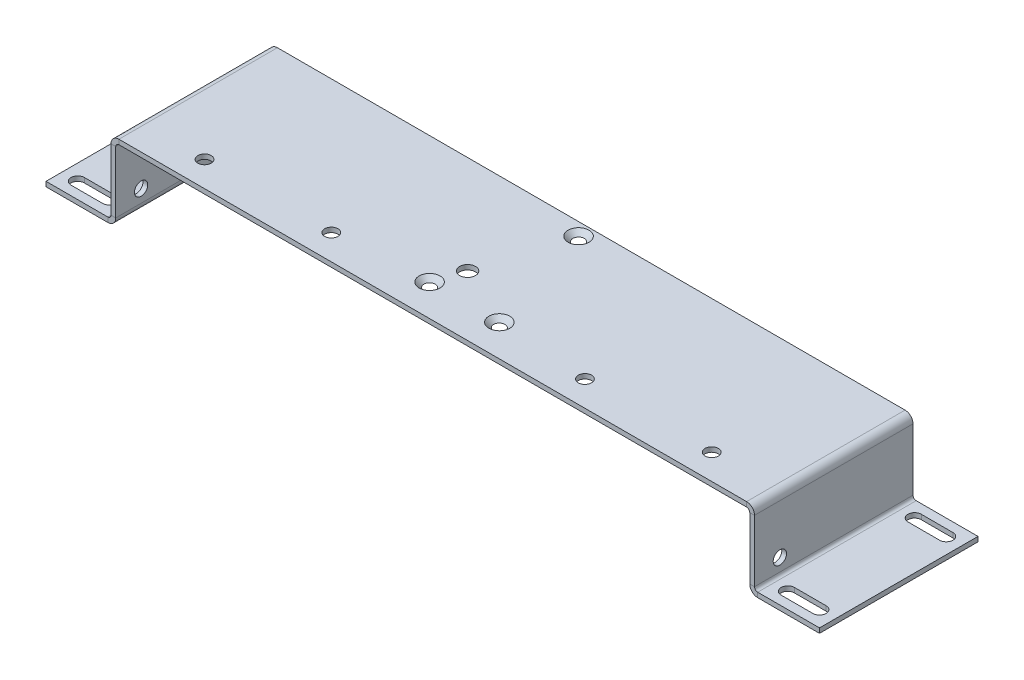
from build123d import *

# Parameters (mm, degrees)
SM_BASE_FLANGE_1_DEPTH       = 50
HOLE_WIZARD_1_AT_2_COUNT     = 2
HOLE_WIZARD_1_AT_2_PITCH     = 37.643060449
HOLE_WIZARD_1_AT_3_COUNT     = 2
HOLE_WIZARD_1_AT_3_PITCH     = 37.643060449
HOLE_WIZARD_4_2_4_2_1_D      = 4.2
HOLE_WIZARD_4_2_4_2_2_REACH  = 232.331
HOLE_WIZARD_4_2_4_2_2_BORE_R = 2.1
CUT_EXTRUDE_1_DEPTH          = 134.839456066
HOLE_WIZARD_5_0_5_1_D        = 5


# Read off the part's stored shape, not the designer's step: 基体-法兰1
with BuildPart() as part:
    # 基体-法兰1 outline → 基体-法兰1 (new body)
    with BuildSketch(Plane.XY):
        with BuildLine():
            Line((102.5, 0), (122, 0))
            Line((122, 0), (122, 1.5))
            Line((122, 1.5), (102.5, 1.5))
            ThreePointArc((102.5, 1.5), (101.792893219, 1.792893219), (101.5, 2.5))
            Line((101.5, 2.5), (101.5, 22))
            ThreePointArc((101.5, 22), (100.767766953, 23.767766953), (99, 24.5))
            Line((99, 24.5), (-99, 24.5))
            ThreePointArc((-99, 24.5), (-100.767766953, 23.767766953), (-101.5, 22))
            Line((-101.5, 22), (-101.5, 2.5))
            ThreePointArc((-101.5, 2.5), (-101.792893219, 1.792893219), (-102.5, 1.5))
            Line((-102.5, 1.5), (-122, 1.5))
            Line((-122, 1.5), (-122, 0))
            Line((-122, 0), (-102.5, 0))
            ThreePointArc((-102.5, 0), (-100.732233047, 0.732233047), (-100, 2.5))
            Line((-100, 2.5), (-100, 22))
            ThreePointArc((-100, 22), (-99.707106781, 22.707106781), (-99, 23))
            Line((-99, 23), (99, 23))
            ThreePointArc((99, 23), (99.707106781, 22.707106781), (100, 22))
            Line((100, 22), (100, 2.5))
            ThreePointArc((100, 2.5), (100.732233047, 0.732233047), (102.5, 0))
        make_face()
    extrude(amount=SM_BASE_FLANGE_1_DEPTH)

    # 草图9 → 打孔尺寸(%根据)开槽沉头木螺钉的类型1 (revolve, cut)
    with BuildSketch(Plane(origin=(0, 24.5, 4), x_dir=(0, 0, 1), z_dir=(1, 0, 0))):
        Polygon((0, 0), (0, 1.5), (1.7, 1.5), (1.7, 1.6), (3.3, 0), align=None)
    hole_wizard_1 = revolve(axis=Axis((0, 30.85, 4), (0, -1, 0)), mode=Mode.SUBTRACT)

    # 打孔尺寸(%根据)开槽沉头木螺钉的类型1 at 2: 打孔尺寸(%根据)开槽沉头木螺钉的类型1 ×2
    with Locations(*[Vector(-0.29221853559902017, 0, 0.956351571051339) * (i * HOLE_WIZARD_1_AT_2_PITCH) for i in range(1, HOLE_WIZARD_1_AT_2_COUNT)]):
        add(hole_wizard_1, mode=Mode.SUBTRACT)

    # 打孔尺寸(%根据)开槽沉头木螺钉的类型1 at 3: 打孔尺寸(%根据)开槽沉头木螺钉的类型1 ×2
    with Locations(*[Vector(0.2922185355990204, 0, 0.956351571051339) * (i * HOLE_WIZARD_1_AT_3_PITCH) for i in range(1, HOLE_WIZARD_1_AT_3_COUNT)]):
        add(hole_wizard_1, mode=Mode.SUBTRACT)

    # Ø4.2 (4.2) 直径孔1 (through all)
    with Locations(Plane(origin=(0, 24.5, 0), x_dir=(1, 0, 0), z_dir=(0, 1, 0))):
        with Locations((-40, -42), (-80, -42), (40, -42), (80, -42)):
            Hole(HOLE_WIZARD_4_2_4_2_1_D / 2)

    # Ø4.2 (4.2) 直径孔2 bore → Ø4.2 (4.2) 直径孔2 (cut, up to next)
    with BuildSketch(Plane(origin=(101.5, 0, 0), x_dir=(0, 0, -1), z_dir=(1, 0, 0)), mode=Mode.PRIVATE) as hole_wizard_4_2_4_2_2_sk1:
        with Locations((-42, 6.5)):
            Circle(HOLE_WIZARD_4_2_4_2_2_BORE_R)
    hole_wizard_4_2_4_2_2_tool1 = extrude(hole_wizard_4_2_4_2_2_sk1.sketch, amount=-HOLE_WIZARD_4_2_4_2_2_REACH, mode=Mode.PRIVATE) & part.part
    hole_wizard_4_2_4_2_2 = hole_wizard_4_2_4_2_2_tool1.solids().sort_by_distance((101.5, 6.5, 42))[0]
    add(hole_wizard_4_2_4_2_2, mode=Mode.SUBTRACT)

    # 镜向1: Ø4.2 (4.2) 直径孔2 across plane
    add(hole_wizard_4_2_4_2_2.mirror(Plane(origin=(0, 0, 0), x_dir=(0, 0, 1), z_dir=(1, 0, 0))), mode=Mode.SUBTRACT)

    # 草图15 → 切除-拉伸1 (cut, through all)
    with BuildSketch(Plane(origin=(0, 1.5, 0), x_dir=(1, 0, 0), z_dir=(0, 1, 0))):
        with BuildLine():
            Line((-117, -2.9), (-107, -2.9))
            ThreePointArc((-107, -2.9), (-104.9, -5), (-107, -7.1))
            Line((-107, -7.1), (-117, -7.1))
            ThreePointArc((-117, -7.1), (-119.1, -5), (-117, -2.9))
        make_face()
        with BuildLine():
            Line((-117, -42.9), (-107, -42.9))
            ThreePointArc((-107, -42.9), (-104.9, -45), (-107, -47.1))
            Line((-107, -47.1), (-117, -47.1))
            ThreePointArc((-117, -47.1), (-119.1, -45), (-117, -42.9))
        make_face()
    cut_extrude_1 = extrude(amount=-CUT_EXTRUDE_1_DEPTH, mode=Mode.SUBTRACT)

    # 镜向2: 切除-拉伸1 across plane
    add(cut_extrude_1.mirror(Plane(origin=(0, 0, 0), x_dir=(0, 0, 1), z_dir=(1, 0, 0))), mode=Mode.SUBTRACT)

    # Ø5.0 (5) 直径孔1 (through all)
    with Locations(Plane(origin=(0, 24.5, 0), x_dir=(1, 0, 0), z_dir=(0, 1, 0))):
        with Locations((-8, -31)):
            Hole(HOLE_WIZARD_5_0_5_1_D / 2)


solid = part.part
